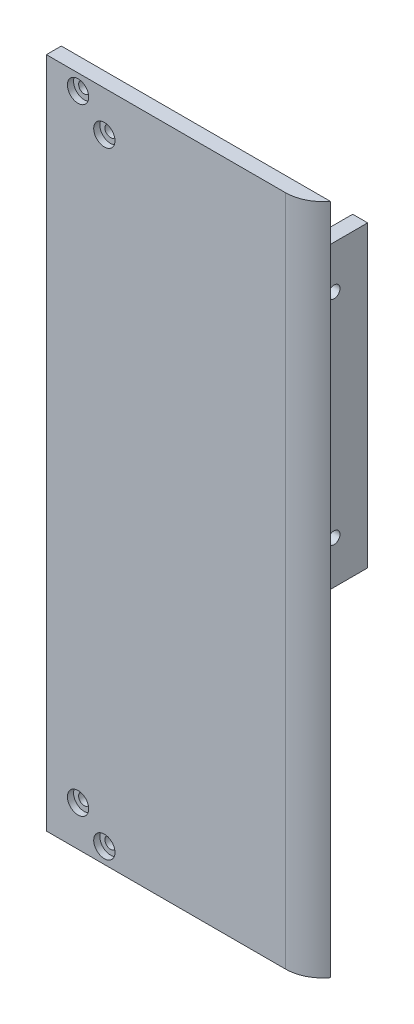
from build123d import *

# Parameters (mm, degrees)
CROQUIS1_W              = 72
CROQUIS1_H              = 180
CROQUIS1_R              = 2.85
CROQUIS1_R_2            = 1.5
SALIENTE_EXTRUIR1_DEPTH = 4
CROQUIS2_R              = 2.85
CORTAR_EXTRUIR1_DEPTH   = 1.65
CROQUIS3_W              = 4
CROQUIS3_H              = 10
SALIENTE_EXTRUIR2_DEPTH = 10
CORTAR_EXTRUIR2_REACH   = 263.951
CROQUIS4_R              = 1.5
CROQUIS4_3_R            = 1.5
CORTAR_EXTRUIR3_DEPTH   = 1.65
REDONDEO3_R             = 10
CROQUIS5_W              = 4
CROQUIS5_H              = 80
SALIENTE_EXTRUIR3_DEPTH = 50
SALIENTE_EXTRUIR4_DEPTH = 5
SALIENTE_EXTRUIR5_DEPTH = 5
CORTAR_EXTRUIR4_REACH   = 263.401
CROQUIS9_R              = 1.6


with BuildPart() as part:
    # Croquis1 → Saliente-Extruir1 (new body)
    # profile 1 of 5: a face of its own
    with BuildSketch(Plane.XY):
        with Locations((32, 162.773389683)):
            Rectangle(CROQUIS1_W, CROQUIS1_H)
        with Locations((4.48, 83.573389683)):
            Circle(CROQUIS1_R, mode=Mode.SUBTRACT)
        with Locations((11.52, 76.973389683)):
            Circle(CROQUIS1_R, mode=Mode.SUBTRACT)
        with Locations((11.52, 241.973389683)):
            Circle(CROQUIS1_R, mode=Mode.SUBTRACT)
        with Locations((4.48, 248.573389683)):
            Circle(CROQUIS1_R, mode=Mode.SUBTRACT)
    # profile 2 of 5: a face of its own
    with BuildSketch(Plane.XY):
        with Locations((4.48, 83.573389683)):
            Circle(CROQUIS1_R)
        with Locations((4.48, 83.573389683)):
            Circle(CROQUIS1_R_2, mode=Mode.SUBTRACT)
    # profile 3 of 5: a face of its own
    with BuildSketch(Plane.XY):
        with Locations((11.52, 76.973389683)):
            Circle(CROQUIS1_R)
        with Locations((11.52, 76.973389683)):
            Circle(CROQUIS1_R_2, mode=Mode.SUBTRACT)
    # profile 4 of 5: a face of its own
    with BuildSketch(Plane.XY):
        with Locations((11.52, 241.973389683)):
            Circle(CROQUIS1_R)
        with Locations((11.52, 241.973389683)):
            Circle(CROQUIS1_R_2, mode=Mode.SUBTRACT)
    # profile 5 of 5: a face of its own
    with BuildSketch(Plane.XY):
        with Locations((4.48, 248.573389683)):
            Circle(CROQUIS1_R)
        with Locations((4.48, 248.573389683)):
            Circle(CROQUIS1_R_2, mode=Mode.SUBTRACT)
    extrude(amount=SALIENTE_EXTRUIR1_DEPTH)

    # Croquis2 → Cortar-Extruir1 (cut)
    with BuildSketch(Plane.XY.offset(4)):
        with Locations((4.48, 248.573389683)):
            Circle(CROQUIS2_R)
        with Locations((11.52, 241.973389683)):
            Circle(CROQUIS2_R)
        with Locations((4.48, 83.573389683)):
            Circle(CROQUIS2_R)
        with Locations((11.52, 76.973389683)):
            Circle(CROQUIS2_R)
    extrude(amount=-CORTAR_EXTRUIR1_DEPTH, mode=Mode.SUBTRACT)

    # Croquis3 → Saliente-Extruir2 (add)
    with BuildSketch(Plane(origin=(0, 0, 0), x_dir=(-1, 0, 0), z_dir=(0, 0, -1))):
        with Locations((-2, 200.273389683)):
            Rectangle(CROQUIS3_W, CROQUIS3_H)
        with Locations((-2, 125.273389683)):
            Rectangle(CROQUIS3_W, CROQUIS3_H)
    extrude(amount=SALIENTE_EXTRUIR2_DEPTH)

    # Croquis4 → Cortar-Extruir2 (cut, up to next)
    with BuildSketch(Plane.ZY, mode=Mode.PRIVATE) as cortar_extruir2_sk1:
        with Locations(Location((-5, 125.273389683, 0), (0, 0, 270))):
            Circle(CROQUIS4_R)
    cortar_extruir2_tool1 = extrude(cortar_extruir2_sk1.sketch, amount=-CORTAR_EXTRUIR2_REACH, mode=Mode.PRIVATE) & part.part
    # Croquis4 → Cortar-Extruir2 (cut, up to next)
    with BuildSketch(Plane.ZY, mode=Mode.PRIVATE) as cortar_extruir2_sk2:
        with Locations(Location((-5, 200.273389683, 0), (0, 0, 270))):
            Circle(CROQUIS4_R)
    cortar_extruir2_tool2 = extrude(cortar_extruir2_sk2.sketch, amount=-CORTAR_EXTRUIR2_REACH, mode=Mode.PRIVATE) & part.part
    add(cortar_extruir2_tool1.solids().sort_by_distance((0, 125.27339, -5))[0], mode=Mode.SUBTRACT)
    add(cortar_extruir2_tool2.solids().sort_by_distance((0, 200.27339, -5))[0], mode=Mode.SUBTRACT)

    # Croquis4<3> → Cortar-Extruir3 (cut)
    # profile 1 of 2: a face of its own
    with BuildSketch(Plane.ZY):
        Polygon((-8.348631561, 200.273389683), (-6.674315781, 197.373389683), (-3.325684219, 197.373389683), (-1.651368439, 200.273389683), (-3.325684219, 203.173389683), (-6.674315781, 203.173389683), align=None)
        with Locations(Location((-5, 200.273389683, 0), (0, 0, 270))):
            Circle(CROQUIS4_3_R, mode=Mode.SUBTRACT)
    # profile 2 of 2: a face of its own
    with BuildSketch(Plane.ZY):
        Polygon((-8.348631561, 125.273389683), (-6.674315781, 122.373389683), (-3.325684219, 122.373389683), (-1.651368439, 125.273389683), (-3.325684219, 128.173389683), (-6.674315781, 128.173389683), align=None)
        with Locations(Location((-5, 125.273389683, 0), (0, 0, 270))):
            Circle(CROQUIS4_3_R, mode=Mode.SUBTRACT)
    extrude(amount=-CORTAR_EXTRUIR3_DEPTH, mode=Mode.SUBTRACT)

    # Redondeo3
    # the kernel refuses this fillet: 10 mm, written as the material it takes off along each edge
    with BuildSketch(Plane(origin=(68, 52.773389683, 4), x_dir=(0, 0, -1), z_dir=(0, 1, 0))) as redondeo3_piece_1:
        with BuildLine():
            CenterArc((10, 8), REDONDEO3_R, 180, 53.130102354)
            Line((0, 8), (-0.2, 8))
            Line((-0.2, 8), (-0.2, 0))
            Line((-0.2, 0), (0, -0.2))
            ThreePointArc((0, -0.2), (2, -0.2), (3.88, -0.16))
            Line((3.88, -0.16), (4, 0))
        make_face()
    extrude(amount=220, mode=Mode.SUBTRACT)

    # Croquis5 → Saliente-Extruir3 (add)
    with BuildSketch(Plane(origin=(0, 0, 0), x_dir=(-1, 0, 0), z_dir=(0, 0, -1))):
        with Locations((-26, 162.773389683)):
            Rectangle(CROQUIS5_W, CROQUIS5_H)
    extrude(amount=SALIENTE_EXTRUIR3_DEPTH)

    # Croquis6 → Saliente-Extruir4 (add)
    with BuildSketch(Plane(origin=(0, 202.773389683, 0), x_dir=(1, 0, 0), z_dir=(0, 1, 0))):
        Polygon((28, 0), (33, 0), (28, 10), align=None)
    extrude(amount=-SALIENTE_EXTRUIR4_DEPTH)

    # Croquis7 → Saliente-Extruir5 (add)
    with BuildSketch(Plane.XZ.offset(-122.773389683)):
        Polygon((28, 0), (33, 0), (28, -10), align=None)
    extrude(amount=-SALIENTE_EXTRUIR5_DEPTH)

    # Croquis9 → Cortar-Extruir4 (cut, up to next)
    with BuildSketch(Plane.ZY.offset(-24), mode=Mode.PRIVATE) as cortar_extruir4_sk1:
        with Locations(Location((-9, 191.273389683, 0), (0, 0, 270))):
            Circle(CROQUIS9_R)
    cortar_extruir4_tool1 = extrude(cortar_extruir4_sk1.sketch, amount=-CORTAR_EXTRUIR4_REACH, mode=Mode.PRIVATE) & part.part
    # Croquis9 → Cortar-Extruir4 (cut, up to next)
    with BuildSketch(Plane.ZY.offset(-24), mode=Mode.PRIVATE) as cortar_extruir4_sk2:
        with Locations(Location((-41, 191.273389683, 0), (0, 0, 270))):
            Circle(CROQUIS9_R)
    cortar_extruir4_tool2 = extrude(cortar_extruir4_sk2.sketch, amount=-CORTAR_EXTRUIR4_REACH, mode=Mode.PRIVATE) & part.part
    # Croquis9 → Cortar-Extruir4 (cut, up to next)
    with BuildSketch(Plane.ZY.offset(-24), mode=Mode.PRIVATE) as cortar_extruir4_sk3:
        with Locations(Location((-41, 134.273389683, 0), (0, 0, 270))):
            Circle(CROQUIS9_R)
    cortar_extruir4_tool3 = extrude(cortar_extruir4_sk3.sketch, amount=-CORTAR_EXTRUIR4_REACH, mode=Mode.PRIVATE) & part.part
    # Croquis9 → Cortar-Extruir4 (cut, up to next)
    with BuildSketch(Plane.ZY.offset(-24), mode=Mode.PRIVATE) as cortar_extruir4_sk4:
        with Locations(Location((-9, 134.273389683, 0), (0, 0, 270))):
            Circle(CROQUIS9_R)
    cortar_extruir4_tool4 = extrude(cortar_extruir4_sk4.sketch, amount=-CORTAR_EXTRUIR4_REACH, mode=Mode.PRIVATE) & part.part
    add(cortar_extruir4_tool1.solids().sort_by_distance((24, 191.27339, -9))[0], mode=Mode.SUBTRACT)
    add(cortar_extruir4_tool2.solids().sort_by_distance((24, 191.27339, -41))[0], mode=Mode.SUBTRACT)
    add(cortar_extruir4_tool3.solids().sort_by_distance((24, 134.27339, -41))[0], mode=Mode.SUBTRACT)
    add(cortar_extruir4_tool4.solids().sort_by_distance((24, 134.27339, -9))[0], mode=Mode.SUBTRACT)


solid = part.part
